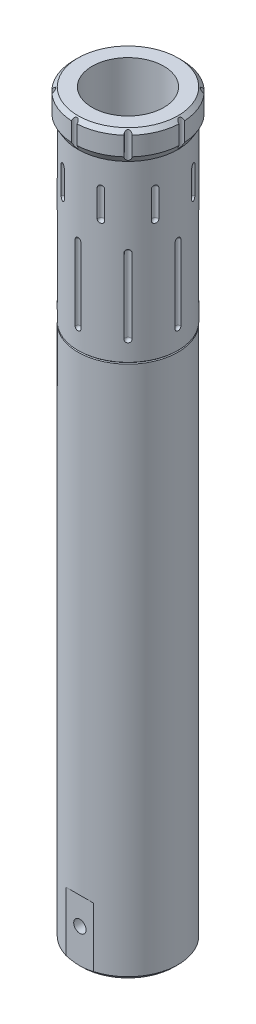
from build123d import *

# Parameters (mm, degrees)
SKETCH1_R                = 6.5
BOSS_EXTRUDE1_DEPTH      = 69.5
SKETCH2_R                = 4.65
BOSS_EXTRUDE2_DEPTH      = 6.6
SKETCH4_R                = 4.15
CUT_EXTRUDE1_DEPTH       = 7
SKETCH5_R                = 1.75
CUT_EXTRUDE2_DEPTH       = 13.75
CHAMFER3_SIZE            = 0.1
SKETCH7_R                = 6.5
SKETCH7_R_2              = 4.65
BOSS_EXTRUDE3_DEPTH      = 6.6
SKETCH8_R                = 6.5
SKETCH8_R_2              = 4.65
BOSS_EXTRUDE4_DEPTH      = 19.9
BOSS_EXTRUDE5_START      = -3.8
SKETCH9_R                = 7
SKETCH9_R_2              = 4.65
BOSS_EXTRUDE5_DEPTH      = 3.8
CHAMFER1_SIZE            = 0.5
CHAMFER2_SIZE2           = 0.866025404
CHAMFER2_SIZE            = 0.5
CHAMFER4_SIZE            = 0.1
BOSS_EXTRUDE6_DEPTH      = 0.01
BOSS_EXTRUDE7_DEPTH      = 1.4
CUT_EXTRUDE4_DEPTH       = 60.521788549
CUT_EXTRUDE4_DEPTH_BACK  = 60.521788549
SKETCH13_OUTSIDE_W       = 35.604
SKETCH13_OUTSIDE_H       = 35.604
CUT_EXTRUDE7_DEPTH       = 97.509066932
CUT_EXTRUDE7_DEPTH_BACK  = 97.509066932
CUT_EXTRUDE8_DEPTH       = 1.5
CUT_EXTRUDE10_DEPTH      = 6.5
BOSS_EXTRUDE9_DEPTH      = 6.5
BOSS_EXTRUDE10_DEPTH     = 6.5
SKETCH22_ONE_SIDE_W      = 0.375
SKETCH22_ONE_SIDE_H      = 3.8
CIRPATTERN2_START        = 92.416507955
CIRPATTERN2_DEPTH        = 3.458490187
CUT_EXTRUDE11_DEPTH      = 97.507610963
CUT_EXTRUDE11_DEPTH_BACK = 97.507610963


# Read off the part's stored shape, not the designer's step: CirPattern2
with BuildPart() as part:
    # Sketch1 → Boss-Extrude1 (new body)
    with BuildSketch(Plane(origin=(0, 0, 0), x_dir=(1, 0, 0), z_dir=(0, 1, 0))):
        with Locations(Location((0, 0, 0), (0, 0, 270))):
            Circle(SKETCH1_R)
    extrude(amount=BOSS_EXTRUDE1_DEPTH)

    # Sketch2 → Boss-Extrude2 (add)
    with BuildSketch(Plane(origin=(0, 69.5, 0), x_dir=(1, 0, 0), z_dir=(0, 1, 0))):
        with Locations(Location((0, 0, 0), (0, 0, 270))):
            Circle(SKETCH2_R)
    extrude(amount=BOSS_EXTRUDE2_DEPTH)

    # Sketch4 → Cut-Extrude1 (cut)
    with BuildSketch(Plane(origin=(0, 76.1, 0), x_dir=(1, 0, 0), z_dir=(0, 1, 0))):
        with Locations(Location((0, 0, 0), (0, 0, 270))):
            Circle(SKETCH4_R)
    extrude(amount=-CUT_EXTRUDE1_DEPTH, mode=Mode.SUBTRACT)

    # Sketch5 → Cut-Extrude2 (cut)
    with BuildSketch(Plane(origin=(0, 69.1, 0), x_dir=(1, 0, 0), z_dir=(0, 1, 0))):
        with Locations(Location((0, 0, 0), (0, 0, 270))):
            Circle(SKETCH5_R)
    extrude(amount=-CUT_EXTRUDE2_DEPTH, mode=Mode.SUBTRACT)

    # Chamfer3
    chamfer3_edges = [part.edges().sort_by_distance(p)[0] for p in [
        (0, 69.5, -6.5),
    ]]
    chamfer(chamfer3_edges, length=CHAMFER3_SIZE)



with BuildPart() as body_2:
    # Sketch7 → Boss-Extrude3 (new body)
    with BuildSketch(Plane(origin=(0, 69.5, 0), x_dir=(1, 0, 0), z_dir=(0, 1, 0))):
        with Locations(Location((0, 0, 0), (0, 0, 90))):
            Circle(SKETCH7_R)
        with Locations(Location((0, 0, 0), (0, 0, 270))):
            Circle(SKETCH7_R_2, mode=Mode.SUBTRACT)
    extrude(amount=BOSS_EXTRUDE3_DEPTH)


with BuildPart() as part_1:
    add(part.part)

    add(body_2.part)  # Boss-Extrude4 merges body 2
    # Sketch8 → Boss-Extrude4 (add)
    with BuildSketch(Plane(origin=(0, 76.1, 0), x_dir=(1, 0, 0), z_dir=(0, 1, 0))):
        with Locations(Location((0, 0, 0), (0, 0, 90))):
            Circle(SKETCH8_R)
        with Locations(Location((0, 0, 0), (0, 0, 90))):
            Circle(SKETCH8_R_2, mode=Mode.SUBTRACT)
    extrude(amount=BOSS_EXTRUDE4_DEPTH)

    # Sketch9 → Boss-Extrude5 (add)
    with BuildSketch(Plane(origin=(0, 96, 0), x_dir=(1, 0, 0), z_dir=(0, 1, 0)).offset(BOSS_EXTRUDE5_START)):
        with Locations(Location((0, 0, 0), (0, 0, 270))):
            Circle(SKETCH9_R)
        with Locations(Location((0, 0, 0), (0, 0, 90))):
            Circle(SKETCH9_R_2, mode=Mode.SUBTRACT)
    extrude(amount=BOSS_EXTRUDE5_DEPTH)

    # Chamfer1
    chamfer1_edges = [part_1.edges().sort_by_distance(p)[0] for p in [
        (0, 0, -6.5),
        (0, 96, -7),
    ]]
    chamfer(chamfer1_edges, length=CHAMFER1_SIZE)

    # Chamfer2
    chamfer2_edges = [part_1.edges().sort_by_distance(p)[0] for p in [
        (0, 92.2, -7),
    ]]
    chamfer2_side = [part_1.faces().sort_by_distance(p)[0] for p in [
        (0, 92.2, -6.99),
    ]]
    chamfer(chamfer2_edges, length=CHAMFER2_SIZE - 0.0001, length2=CHAMFER2_SIZE2 - 0.0001, reference=chamfer2_side[0])  # a hair under: the kernel refuses the full size

    # Chamfer4
    chamfer4_edges = [part_1.edges().sort_by_distance(p)[0] for p in [
        (0, 69.5, 6.5),
    ]]
    chamfer(chamfer4_edges, length=CHAMFER4_SIZE - 0.0001)  # a hair under: the kernel refuses the full size

    # Sketch10 → Cut-Revolve1 (revolve, cut)
    with BuildSketch(Plane(origin=(0, 0, 0), x_dir=(0, 0, -1), z_dir=(1, 0, 0))):
        Polygon((5.25, 9.265063509), (6.5, 7.1), (6.5, 32.3), (5.25, 32.3), align=None)
    revolve(axis=Axis((0, 32.3, 994.75), (0, 0, -1)), mode=Mode.SUBTRACT)

    # Sketch15 → Cut-Extrude8 (cut)
    with BuildSketch(Plane.XZ):
        with BuildLine():
            Line((-2.875, 3.25), (2.875, 3.25))
            ThreePointArc((2.875, 3.25), (4.5, 1.625), (2.875, 0))
            Line((2.875, 0), (-2.875, 0))
            ThreePointArc((-2.875, 0), (-4.5, 1.625), (-2.875, 3.25))
        make_face()
    extrude(amount=-CUT_EXTRUDE8_DEPTH, mode=Mode.SUBTRACT)

    # Sketch18 → Cut-Extrude10 (cut)
    with BuildSketch(Plane.XZ.offset(-1.5)):
        with BuildLine():
            Line((-2.875, 0), (2.875, 0))
            ThreePointArc((2.875, 0), (4.5, 1.625), (2.875, 3.25))
            Line((2.875, 3.25), (-2.875, 3.25))
            ThreePointArc((-2.875, 3.25), (-4.5, 1.625), (-2.875, 0))
        make_face()
    extrude(amount=-CUT_EXTRUDE10_DEPTH, mode=Mode.SUBTRACT)

    # Sketch21 → Cut-Revolve5 (revolve, cut)
    with BuildSketch(Plane(origin=(0, 0, 0), x_dir=(0, 0, -1), z_dir=(1, 0, 0))):
        with BuildLine():
            Line((6.5, 82.3), (6.5, 71.8))
            ThreePointArc((6.5, 71.8), (6.765165043, 71.909834957), (6.875, 72.175))
            Line((6.875, 72.175), (6.875, 81.925))
            ThreePointArc((6.875, 81.925), (6.765165043, 82.190165043), (6.5, 82.3))
        make_face()
    revolve(axis=Axis((0, 69.6, -6.5), (0, 1, 0)), mode=Mode.SUBTRACT)

    # Sketch22 one side → Cut-Revolve6 (revolve, cut)
    with BuildSketch(Plane(origin=(0, 0, 0), x_dir=(0, 0, -1), z_dir=(1, 0, 0))):
        with Locations((6.8125, 94.1)):
            Rectangle(SKETCH22_ONE_SIDE_W, SKETCH22_ONE_SIDE_H)
    revolve(axis=Axis((0, 93.066025404, -7), (0, 1, 0)), mode=Mode.SUBTRACT)

    # Sketch23 → Cut-Revolve7 (revolve, cut)
    with BuildSketch(Plane(origin=(0, 0, 0), x_dir=(0.3826834323650906, 0, -0.9238795325112865), z_dir=(0.9238795325112865, 0, 0.3826834323650906))):
        with BuildLine():
            Line((6.5, 89.200286557), (6.5, 84.900286557))
            ThreePointArc((6.5, 84.900286557), (6.765165043, 85.010121514), (6.875, 85.275286557))
            Line((6.875, 85.275286557), (6.875, 88.825286557))
            ThreePointArc((6.875, 88.825286557), (6.765165043, 89.0904516), (6.5, 89.200286557))
        make_face()
    revolve(axis=Axis((2.48744231, 69.6, -6.005216961), (0, 1, 0)), mode=Mode.SUBTRACT)

    # CirPattern2 outline → CirPattern2 (cut)
    with BuildSketch(Plane(origin=(0, 0, 0), x_dir=(1, 0, 0), z_dir=(0, 1, 0)).offset(CIRPATTERN2_START)):
        with BuildLine():
            ThreePointArc((4.677574932, 5.207714735), (4.684582425, 4.684582425), (5.207714735, 4.677574932))
            ThreePointArc((5.207714735, 4.677574932), (4.949747468, 4.949747468), (4.677574932, 5.207714735))
        make_face()
        with BuildLine():
            ThreePointArc((6.989955357, 0.374865449), (6.625, 0), (6.989955357, -0.374865449))
            ThreePointArc((6.989955357, -0.374865449), (7, 0), (6.989955357, 0.374865449))
        make_face()
        with BuildLine():
            ThreePointArc((5.207714735, -4.677574932), (4.684582425, -4.684582425), (4.677574932, -5.207714735))
            ThreePointArc((4.677574932, -5.207714735), (4.949747468, -4.949747468), (5.207714735, -4.677574932))
        make_face()
        with BuildLine():
            ThreePointArc((0.374865449, -6.989955357), (0, -6.625), (-0.374865449, -6.989955357))
            ThreePointArc((-0.374865449, -6.989955357), (0, -7), (0.374865449, -6.989955357))
        make_face()
        with BuildLine():
            ThreePointArc((-4.677574932, -5.207714735), (-4.684582425, -4.684582425), (-5.207714735, -4.677574932))
            ThreePointArc((-5.207714735, -4.677574932), (-4.949747468, -4.949747468), (-4.677574932, -5.207714735))
        make_face()
        with BuildLine():
            ThreePointArc((-6.989955357, -0.374865449), (-6.625, 0), (-6.989955357, 0.374865449))
            ThreePointArc((-6.989955357, 0.374865449), (-7, 0), (-6.989955357, -0.374865449))
        make_face()
        with BuildLine():
            ThreePointArc((-5.207714735, 4.677574932), (-4.684582425, 4.684582425), (-4.677574932, 5.207714735))
            ThreePointArc((-4.677574932, 5.207714735), (-4.949747468, 4.949747468), (-5.207714735, 4.677574932))
        make_face()
    extrude(amount=CIRPATTERN2_DEPTH, mode=Mode.SUBTRACT)

    # CirPattern2 2 outline → CirPattern2 2 (revolve, cut)
    with BuildSketch(Plane(origin=(-4.596194078, 0, -4.596194078), x_dir=(1, 0, 0), z_dir=(0, 0, 1))):
        with BuildLine():
            Line((0.375, 72.175000001), (0.375, 81.924999999))
            ThreePointArc((0.375, 81.924999999), (0.265165043, 82.190165043), (0, 82.3))
            Line((0, 82.3), (0, 71.8))
            ThreePointArc((0, 71.8), (0.265165043, 71.909834957), (0.375, 72.175000001))
        make_face()
    revolve(axis=Axis((-4.596194078, 0, -4.596194078), (0, 1, 0)), mode=Mode.SUBTRACT)

    # CirPattern2 3 outline → CirPattern2 3 (revolve, cut)
    with BuildSketch(Plane(origin=(-6.5, 0, 0), x_dir=(1, 0, 0), z_dir=(0, 0, 1))):
        with BuildLine():
            Line((0.375, 72.175000001), (0.375, 81.924999999))
            ThreePointArc((0.375, 81.924999999), (0.265165043, 82.190165043), (0, 82.3))
            Line((0, 82.3), (0, 71.8))
            ThreePointArc((0, 71.8), (0.265165043, 71.909834957), (0.375, 72.175000001))
        make_face()
    revolve(axis=Axis((-6.5, 0, 0), (0, 1, 0)), mode=Mode.SUBTRACT)

    # CirPattern2 4 outline → CirPattern2 4 (revolve, cut)
    with BuildSketch(Plane(origin=(-4.596194078, 0, 4.596194078), x_dir=(1, 0, 0), z_dir=(0, 0, 1))):
        with BuildLine():
            Line((0.375, 72.175000001), (0.375, 81.924999999))
            ThreePointArc((0.375, 81.924999999), (0.265165043, 82.190165043), (0, 82.3))
            Line((0, 82.3), (0, 71.8))
            ThreePointArc((0, 71.8), (0.265165043, 71.909834957), (0.375, 72.175000001))
        make_face()
    revolve(axis=Axis((-4.596194078, 0, 4.596194078), (0, 1, 0)), mode=Mode.SUBTRACT)

    # CirPattern2 5 outline → CirPattern2 5 (revolve, cut)
    with BuildSketch(Plane.XY.offset(6.5)):
        with BuildLine():
            Line((0.375, 72.175000001), (0.375, 81.924999999))
            ThreePointArc((0.375, 81.924999999), (0.265165043, 82.190165043), (0, 82.3))
            Line((0, 82.3), (0, 71.8))
            ThreePointArc((0, 71.8), (0.265165043, 71.909834957), (0.375, 72.175000001))
        make_face()
    revolve(axis=Axis((0, 0, 6.5), (0, 1, 0)), mode=Mode.SUBTRACT)

    # CirPattern2 6 outline → CirPattern2 6 (revolve, cut)
    with BuildSketch(Plane(origin=(4.596194078, 0, 4.596194078), x_dir=(1, 0, 0), z_dir=(0, 0, 1))):
        with BuildLine():
            Line((0.375, 72.175000001), (0.375, 81.924999999))
            ThreePointArc((0.375, 81.924999999), (0.265165043, 82.190165043), (0, 82.3))
            Line((0, 82.3), (0, 71.8))
            ThreePointArc((0, 71.8), (0.265165043, 71.909834957), (0.375, 72.175000001))
        make_face()
    revolve(axis=Axis((4.596194078, 0, 4.596194078), (0, 1, 0)), mode=Mode.SUBTRACT)

    # CirPattern2 7 outline → CirPattern2 7 (revolve, cut)
    with BuildSketch(Plane(origin=(6.5, 0, 0), x_dir=(1, 0, 0), z_dir=(0, 0, 1))):
        with BuildLine():
            Line((0.375, 72.175000001), (0.375, 81.924999999))
            ThreePointArc((0.375, 81.924999999), (0.265165043, 82.190165043), (0, 82.3))
            Line((0, 82.3), (0, 71.8))
            ThreePointArc((0, 71.8), (0.265165043, 71.909834957), (0.375, 72.175000001))
        make_face()
    revolve(axis=Axis((6.5, 0, 0), (0, 1, 0)), mode=Mode.SUBTRACT)

    # CirPattern2 8 outline → CirPattern2 8 (revolve, cut)
    with BuildSketch(Plane(origin=(4.596194078, 0, -4.596194078), x_dir=(1, 0, 0), z_dir=(0, 0, 1))):
        with BuildLine():
            Line((0.375, 72.175000001), (0.375, 81.924999999))
            ThreePointArc((0.375, 81.924999999), (0.265165043, 82.190165043), (0, 82.3))
            Line((0, 82.3), (0, 71.8))
            ThreePointArc((0, 71.8), (0.265165043, 71.909834957), (0.375, 72.175000001))
        make_face()
    revolve(axis=Axis((4.596194078, 0, -4.596194078), (0, 1, 0)), mode=Mode.SUBTRACT)

    # CirPattern2 9 outline → CirPattern2 9 (revolve, cut)
    with BuildSketch(Plane(origin=(-2.48744231, 0, -6.005216961), x_dir=(1, 0, 0), z_dir=(0, 0, 1))):
        with BuildLine():
            Line((0.375, 85.275286558), (0.375, 88.825286556))
            ThreePointArc((0.375, 88.825286556), (0.265165043, 89.0904516), (0, 89.200286557))
            Line((0, 89.200286557), (0, 84.900286557))
            ThreePointArc((0, 84.900286557), (0.265165043, 85.010121514), (0.375, 85.275286558))
        make_face()
    revolve(axis=Axis((-2.48744231, 0, -6.005216961), (0, 1, 0)), mode=Mode.SUBTRACT)

    # CirPattern2 10 outline → CirPattern2 10 (revolve, cut)
    with BuildSketch(Plane(origin=(-6.005216961, 0, -2.48744231), x_dir=(1, 0, 0), z_dir=(0, 0, 1))):
        with BuildLine():
            Line((0.375, 85.275286558), (0.375, 88.825286556))
            ThreePointArc((0.375, 88.825286556), (0.265165043, 89.0904516), (0, 89.200286557))
            Line((0, 89.200286557), (0, 84.900286557))
            ThreePointArc((0, 84.900286557), (0.265165043, 85.010121514), (0.375, 85.275286558))
        make_face()
    revolve(axis=Axis((-6.005216961, 0, -2.48744231), (0, 1, 0)), mode=Mode.SUBTRACT)

    # CirPattern2 11 outline → CirPattern2 11 (revolve, cut)
    with BuildSketch(Plane(origin=(-6.005216961, 0, 2.48744231), x_dir=(1, 0, 0), z_dir=(0, 0, 1))):
        with BuildLine():
            Line((0.375, 85.275286558), (0.375, 88.825286556))
            ThreePointArc((0.375, 88.825286556), (0.265165043, 89.0904516), (0, 89.200286557))
            Line((0, 89.200286557), (0, 84.900286557))
            ThreePointArc((0, 84.900286557), (0.265165043, 85.010121514), (0.375, 85.275286558))
        make_face()
    revolve(axis=Axis((-6.005216961, 0, 2.48744231), (0, 1, 0)), mode=Mode.SUBTRACT)

    # CirPattern2 12 outline → CirPattern2 12 (revolve, cut)
    with BuildSketch(Plane(origin=(-2.48744231, 0, 6.005216961), x_dir=(1, 0, 0), z_dir=(0, 0, 1))):
        with BuildLine():
            Line((0.375, 85.275286558), (0.375, 88.825286556))
            ThreePointArc((0.375, 88.825286556), (0.265165043, 89.0904516), (0, 89.200286557))
            Line((0, 89.200286557), (0, 84.900286557))
            ThreePointArc((0, 84.900286557), (0.265165043, 85.010121514), (0.375, 85.275286558))
        make_face()
    revolve(axis=Axis((-2.48744231, 0, 6.005216961), (0, 1, 0)), mode=Mode.SUBTRACT)

    # CirPattern2 13 outline → CirPattern2 13 (revolve, cut)
    with BuildSketch(Plane(origin=(2.48744231, 0, 6.005216961), x_dir=(1, 0, 0), z_dir=(0, 0, 1))):
        with BuildLine():
            Line((0.375, 85.275286558), (0.375, 88.825286556))
            ThreePointArc((0.375, 88.825286556), (0.265165043, 89.0904516), (0, 89.200286557))
            Line((0, 89.200286557), (0, 84.900286557))
            ThreePointArc((0, 84.900286557), (0.265165043, 85.010121514), (0.375, 85.275286558))
        make_face()
    revolve(axis=Axis((2.48744231, 0, 6.005216961), (0, 1, 0)), mode=Mode.SUBTRACT)

    # CirPattern2 14 outline → CirPattern2 14 (revolve, cut)
    with BuildSketch(Plane(origin=(6.005216961, 0, 2.48744231), x_dir=(1, 0, 0), z_dir=(0, 0, 1))):
        with BuildLine():
            Line((0.375, 85.275286558), (0.375, 88.825286556))
            ThreePointArc((0.375, 88.825286556), (0.265165043, 89.0904516), (0, 89.200286557))
            Line((0, 89.200286557), (0, 84.900286557))
            ThreePointArc((0, 84.900286557), (0.265165043, 85.010121514), (0.375, 85.275286558))
        make_face()
    revolve(axis=Axis((6.005216961, 0, 2.48744231), (0, 1, 0)), mode=Mode.SUBTRACT)

    # CirPattern2 15 outline → CirPattern2 15 (revolve, cut)
    with BuildSketch(Plane(origin=(6.005216961, 0, -2.48744231), x_dir=(1, 0, 0), z_dir=(0, 0, 1))):
        with BuildLine():
            Line((0.375, 85.275286558), (0.375, 88.825286556))
            ThreePointArc((0.375, 88.825286556), (0.265165043, 89.0904516), (0, 89.200286557))
            Line((0, 89.200286557), (0, 84.900286557))
            ThreePointArc((0, 84.900286557), (0.265165043, 85.010121514), (0.375, 85.275286558))
        make_face()
    revolve(axis=Axis((6.005216961, 0, -2.48744231), (0, 1, 0)), mode=Mode.SUBTRACT)

    # Sketch24 → Cut-Extrude11 (cut, two sides: drawn at the far end of the back side and taken through both)
    with BuildSketch(Plane(origin=(0, 0, 0), x_dir=(0, 0, -1), z_dir=(1, 0, 0)).offset(-CUT_EXTRUDE11_DEPTH_BACK)):
        Polygon((-6.25, 0), (-6.25, 8.2), (-6.5, 8.45), (-6.5, 0), align=None)
    extrude(amount=CUT_EXTRUDE11_DEPTH + CUT_EXTRUDE11_DEPTH_BACK, mode=Mode.SUBTRACT)


with BuildPart() as body_2_2:
    # Sketch11 → Boss-Extrude6 (new body)
    with BuildSketch(Plane(origin=(0, 0, -5.25), x_dir=(-1, 0, 0), z_dir=(0, 0, -1))):
        with BuildLine():
            Line((-3.732427429, 34.94665095), (-3.732427429, 10.583476069))
            ThreePointArc((-3.732427429, 10.583476069), (0, 10.265063509), (3.732427429, 10.583476069))
            Line((3.732427429, 10.583476069), (3.732427429, 34.94665095))
            ThreePointArc((3.732427429, 34.94665095), (0, 35.265063509), (-3.732427429, 34.94665095))
        make_face()
    extrude(amount=BOSS_EXTRUDE6_DEPTH)


with BuildPart() as body_3:
    # Sketch12 → Boss-Extrude7 (new body)
    with BuildSketch(Plane(origin=(0, 0, -5.25), x_dir=(-1, 0, 0), z_dir=(0, 0, -1))):
        with BuildLine():
            ThreePointArc((-2.75, 37.307212435), (0, 37.134936491), (2.75, 37.307212435))
            ThreePointArc((2.75, 37.307212435), (3.125, 45.734936491), (2.75, 54.162660546))
            ThreePointArc((2.75, 54.162660546), (0, 54.334936491), (-2.75, 54.162660546))
            ThreePointArc((-2.75, 54.162660546), (-3.125, 45.734936491), (-2.75, 37.307212435))
        make_face()
    extrude(amount=BOSS_EXTRUDE7_DEPTH)

    # Sketch13 outside → Cut-Extrude4 (cut, two sides: drawn at the far end of the back side and taken through both)
    with BuildSketch(Plane(origin=(0, 37.307212435, 0), x_dir=(-1, 0, 0), z_dir=(0, -1, 0)).offset(-CUT_EXTRUDE4_DEPTH_BACK)):
        Rectangle(SKETCH13_OUTSIDE_W, SKETCH13_OUTSIDE_H)
        with BuildLine():
            ThreePointArc((-0.1875, 6.65), (-1.774076995, 6.338430666), (-3.125, 5.45))
            Line((-3.125, 5.45), (-3.125, 5.25))
            Line((-3.125, 5.25), (2.75, 5.25))
            Line((2.75, 5.25), (2.75, 5.45))
            ThreePointArc((2.75, 5.45), (1.399076995, 6.338430666), (-0.1875, 6.65))
        make_face(mode=Mode.SUBTRACT)
    extrude(amount=CUT_EXTRUDE4_DEPTH + CUT_EXTRUDE4_DEPTH_BACK, mode=Mode.SUBTRACT)

    # Sketch14 → Cut-Extrude7 (cut, two sides: drawn at the far end of the back side and taken through both)
    with BuildSketch(Plane(origin=(0, 0, 0), x_dir=(0, 0, -1), z_dir=(1, 0, 0)).offset(-CUT_EXTRUDE7_DEPTH_BACK)):
        Polygon((5.746255652, 54.334936491), (5.776487383, 54.162660546), (6.65, 49.184936491), (6.645808027, 54.334936491), align=None)
        Polygon((6.65, 42.284936491), (5.776487383, 37.307212435), (5.746255652, 37.134936491), (6.645808027, 37.134936491), align=None)
        Polygon((6.65, 42.284936491), (7.14395645, 37.091946394), (6.645808027, 37.134936491), align=None)
        Polygon((6.65, 49.184936491), (7.14395645, 54.377926587), (6.645808027, 54.334936491), align=None)
    extrude(amount=CUT_EXTRUDE7_DEPTH + CUT_EXTRUDE7_DEPTH_BACK, mode=Mode.SUBTRACT)


with BuildPart() as body_4:
    # Sketch16 → Boss-Extrude9 (new body)
    with BuildSketch(Plane.XZ.offset(-8)):
        with BuildLine():
            Line((-2.875, 0), (2.875, 0))
            ThreePointArc((2.875, 0), (4.5, 1.625), (2.875, 3.25))
            Line((2.875, 3.25), (-2.875, 3.25))
            ThreePointArc((-2.875, 3.25), (-4.5, 1.625), (-2.875, 0))
        make_face()
        with BuildLine():
            Line((-2.875, 0.25), (2.875, 0.25))
            ThreePointArc((2.875, 0.25), (4.25, 1.625), (2.875, 3))
            Line((2.875, 3), (-2.875, 3))
            ThreePointArc((-2.875, 3), (-4.25, 1.625), (-2.875, 0.25))
        make_face(mode=Mode.SUBTRACT)
    extrude(amount=BOSS_EXTRUDE9_DEPTH)


with BuildPart() as body_5:
    # Sketch20 → Boss-Extrude10 (new body)
    with BuildSketch(Plane.XZ.offset(-8)):
        with BuildLine():
            Line((2.5, 1.25), (-2.5, 1.25))
            ThreePointArc((-2.5, 1.25), (-2.875, 1.625), (-2.5, 2))
            Line((-2.5, 2), (2.5, 2))
            ThreePointArc((2.5, 2), (2.875, 1.625), (2.5, 1.25))
        make_face()
    extrude(amount=BOSS_EXTRUDE10_DEPTH)


with BuildPart() as m2x0_4_tapped_hole2_tool:
    # Sketch26 → M2x0.4 Tapped Hole2 (revolve)
    with BuildSketch(Plane(origin=(0, 4.7, 6.25), x_dir=(0, -1, 0), z_dir=(1, 0, 0))):
        Polygon((0, 0), (0, 3.180688495), (0.8, 2.7), (0.8, 0), align=None)
    revolve(axis=Axis((0, 4.7, 12.6), (0, 0, -1)))


with BuildPart() as part_2:
    add(part_1.part)

    # M2x0.4 Tapped Hole2: cut by m2x0_4_tapped_hole2_tool
    add(m2x0_4_tapped_hole2_tool.part, mode=Mode.SUBTRACT)


with BuildPart() as body_4_1:
    add(body_4.part)

    # M2x0.4 Tapped Hole2: cut by m2x0_4_tapped_hole2_tool
    add(m2x0_4_tapped_hole2_tool.part, mode=Mode.SUBTRACT)


solid = Compound([body_2_2.part, body_3.part, body_5.part, part_2.part, body_4_1.part])
